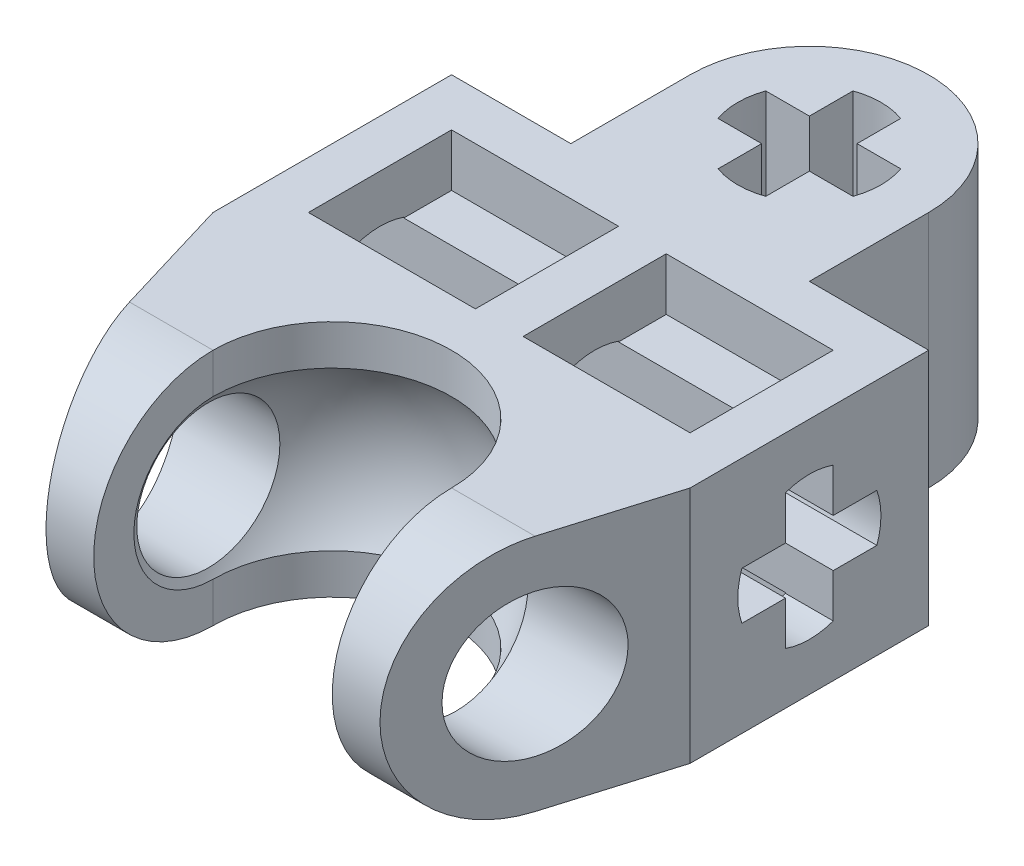
from build123d import *

# Parameters (mm, degrees)
BOSS_EXTRUDE1_DEPTH     = 5
SKETCH3_R               = 1.5
CUT_EXTRUDE1_DEPTH      = 10
CUT_EXTRUDE2_REACH      = 14.247
SKETCH5_R               = 1.658312395
CUT_EXTRUDE4_DEPTH      = 10
CUT_EXTRUDE5_DEPTH      = 10
CUT_EXTRUDE5_DEPTH_BACK = 10
CUT_EXTRUDE6_DEPTH      = 10
SKETCH8_W               = 3.5
SKETCH8_H               = 3
CUT_EXTRUDE13_DEPTH     = 1.1
SKETCH9_W               = 3.5
SKETCH9_H               = 3
CUT_EXTRUDE14_DEPTH     = 1.1


with BuildPart() as part:
    # Sketch1 → Boss-Extrude1 (new body)
    with BuildSketch(Plane(origin=(0, 0, 0), x_dir=(1, 0, 0), z_dir=(0, 1, 0))):
        with BuildLine():
            Line((-5, 5), (-5, -5))
            Line((-5, -5), (5, -5))
            Line((5, -5), (5, 5))
            Line((5, 5), (2.5, 5))
            Line((2.5, 5), (2.5, 7.5))
            ThreePointArc((2.5, 7.5), (0, 10), (-2.5, 7.5))
            Line((-2.5, 7.5), (-2.5, 5))
            Line((-2.5, 5), (-5, 5))
        make_face()
        with BuildLine():
            ThreePointArc((-1.414213562, 7), (-1.5, 7.5), (-1.414213562, 8))
            Line((-1.414213562, 8), (-0.5, 8))
            Line((-0.5, 8), (-0.5, 8.914213562))
            ThreePointArc((-0.5, 8.914213562), (0, 9), (0.5, 8.914213562))
            Line((0.5, 8.914213562), (0.5, 8))
            Line((0.5, 8), (1.414213562, 8))
            ThreePointArc((1.414213562, 8), (1.5, 7.5), (1.414213562, 7))
            Line((1.414213562, 7), (0.5, 7))
            Line((0.5, 7), (0.5, 6.085786438))
            ThreePointArc((0.5, 6.085786438), (0, 6), (-0.5, 6.085786438))
            Line((-0.5, 6.085786438), (-0.5, 7))
            Line((-0.5, 7), (-1.414213562, 7))
        make_face(mode=Mode.SUBTRACT)
    extrude(amount=BOSS_EXTRUDE1_DEPTH)

    # Sketch2 → Cut-Revolve3 (revolve, cut)
    with BuildSketch(Plane(origin=(0, 0, 0), x_dir=(0, 0, -1), z_dir=(1, 0, 0))):
        with BuildLine():
            Line((-2.5, 5.5), (-2.5, -0.5))
            ThreePointArc((-2.5, -0.5), (0.5, 2.5), (-2.5, 5.5))
        make_face()
    revolve(axis=Axis((0, 5.5, 2.5), (0, -1, 0)), mode=Mode.SUBTRACT)

    # Sketch3 → Cut-Extrude1 (cut)
    with BuildSketch(Plane(origin=(5, 0, 0), x_dir=(0, 0, -1), z_dir=(1, 0, 0))):
        with Locations((-2.5, 2.5)):
            Circle(SKETCH3_R)
    extrude(amount=-CUT_EXTRUDE1_DEPTH, mode=Mode.SUBTRACT)

    # Sketch4 → Cut-Extrude2 (cut, up to next)
    with BuildSketch(Plane(origin=(0, 5, 0), x_dir=(1, 0, 0), z_dir=(0, 1, 0)), mode=Mode.PRIVATE) as cut_extrude2_sk1:
        Polygon((-5, 0), (-3.5, -5), (-5, -5), align=None)
    cut_extrude2_tool1 = extrude(cut_extrude2_sk1.sketch, amount=-CUT_EXTRUDE2_REACH, mode=Mode.PRIVATE) & part.part
    # Sketch4 → Cut-Extrude2 (cut, up to next)
    with BuildSketch(Plane(origin=(0, 5, 0), x_dir=(1, 0, 0), z_dir=(0, 1, 0)), mode=Mode.PRIVATE) as cut_extrude2_sk2:
        Polygon((5, 0), (3.5, -5), (5, -5), align=None)
    cut_extrude2_tool2 = extrude(cut_extrude2_sk2.sketch, amount=-CUT_EXTRUDE2_REACH, mode=Mode.PRIVATE) & part.part
    add(cut_extrude2_tool1.solids().sort_by_distance((-4.5, 5, 3.333333))[0], mode=Mode.SUBTRACT)
    add(cut_extrude2_tool2.solids().sort_by_distance((4.5, 5, 3.333333))[0], mode=Mode.SUBTRACT)

    # Sketch5 → Cut-Extrude4 (cut)
    with BuildSketch(Plane(origin=(0, 5, 0), x_dir=(1, 0, 0), z_dir=(0, 1, 0))):
        with BuildLine():
            ThreePointArc((2.5, -2.5), (0, 0), (-2.5, -2.5))
            Line((-2.5, -2.5), (-2.5, -5))
            Line((-2.5, -5), (2.5, -5))
            Line((2.5, -5), (2.5, -2.5))
        make_face()
        with Locations((0, -2.5)):
            Circle(SKETCH5_R, mode=Mode.SUBTRACT)
    extrude(amount=-CUT_EXTRUDE4_DEPTH, mode=Mode.SUBTRACT)

    # Sketch6 → Cut-Extrude5 (cut, two sides: drawn at the far end of the back side and taken through both)
    with BuildSketch(Plane(origin=(-2.5, 0, 0), x_dir=(0, 0, -1), z_dir=(1, 0, 0)).offset(-CUT_EXTRUDE5_DEPTH_BACK)):
        with BuildLine():
            ThreePointArc((-5, 2.5), (-4.267766953, 4.267766953), (-2.5, 5))
            Line((-2.5, 5), (-5, 5))
            Line((-5, 5), (-5, 2.5))
        make_face()
        with BuildLine():
            Line((-5, 0), (-2.5, 0))
            ThreePointArc((-2.5, 0), (-4.267766953, 0.732233047), (-5, 2.5))
            Line((-5, 2.5), (-5, 0))
        make_face()
    extrude(amount=CUT_EXTRUDE5_DEPTH + CUT_EXTRUDE5_DEPTH_BACK, mode=Mode.SUBTRACT)

    # Sketch7 → Cut-Extrude6 (cut)
    with BuildSketch(Plane.ZY.offset(5)):
        with BuildLine():
            Line((-3.914213562, 2), (-3, 2))
            Line((-3, 2), (-3, 1.085786438))
            ThreePointArc((-3, 1.085786438), (-2.5, 1), (-2, 1.085786438))
            Line((-2, 1.085786438), (-2, 2))
            Line((-2, 2), (-1.085786438, 2))
            ThreePointArc((-1.085786438, 2), (-1, 2.5), (-1.085786438, 3))
            Line((-1.085786438, 3), (-2, 3))
            Line((-2, 3), (-2, 3.914213562))
            ThreePointArc((-2, 3.914213562), (-2.5, 4), (-3, 3.914213562))
            Line((-3, 3.914213562), (-3, 3))
            Line((-3, 3), (-3.914213562, 3))
            ThreePointArc((-3.914213562, 3), (-4, 2.5), (-3.914213562, 2))
        make_face()
    extrude(amount=-CUT_EXTRUDE6_DEPTH, mode=Mode.SUBTRACT)

    # Sketch8 → Cut-Extrude13 (cut)
    with BuildSketch(Plane(origin=(0, 5, 0), x_dir=(1, 0, 0), z_dir=(0, 1, 0))):
        with Locations((-2.25, 2.5)):
            Rectangle(SKETCH8_W, SKETCH8_H)
        with Locations((2.25, 2.5)):
            Rectangle(SKETCH8_W, SKETCH8_H)
    extrude(amount=-CUT_EXTRUDE13_DEPTH, mode=Mode.SUBTRACT)

    # Sketch9 → Cut-Extrude14 (cut)
    with BuildSketch(Plane(origin=(0, 0, 0), x_dir=(-1, 0, 0), z_dir=(0, -1, 0))):
        with Locations((-2.25, 2.5)):
            Rectangle(SKETCH9_W, SKETCH9_H)
        with Locations((2.25, 2.5)):
            Rectangle(SKETCH9_W, SKETCH9_H)
    extrude(amount=-CUT_EXTRUDE14_DEPTH, mode=Mode.SUBTRACT)


solid = part.part
